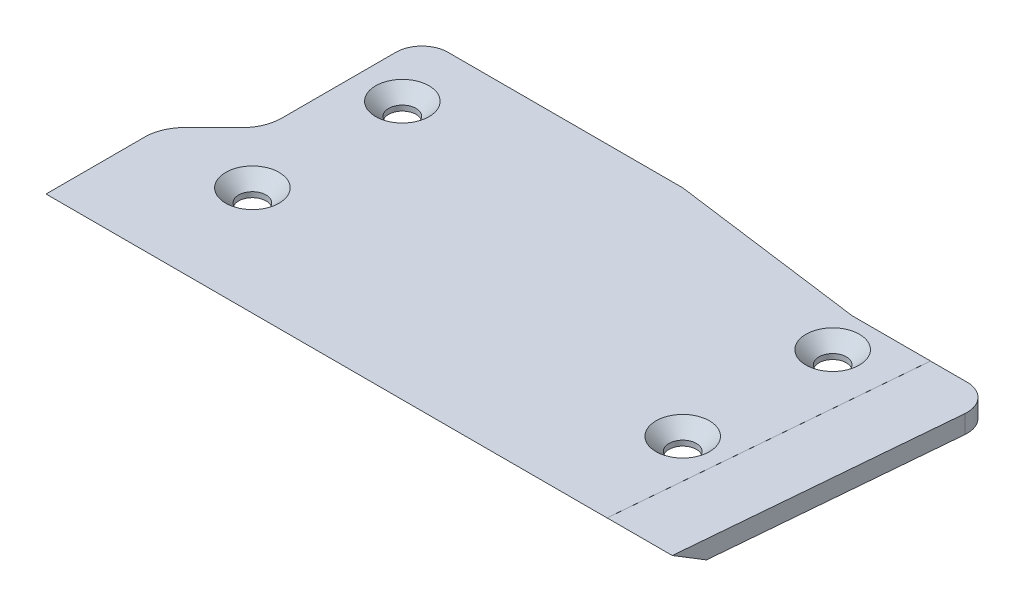
from build123d import *

# Parameters (mm, degrees)
BOSS_EXTRUDE1_DEPTH = 2.8
CHAMFER1_SIZE       = 3
CHAMFER1_SIZE_2     = 5.196152423
SKETCH2_R           = 2.1
CUT_EXTRUDE1_DEPTH  = 103.74283559
CHAMFER2_SIZE       = 2
FILLET1_R           = 6
FILLET2_R           = 4
CUT_EXTRUDE2_DEPTH  = 0.01


with BuildPart() as part:
    # Sketch1 → Boss-Extrude1 (new body)
    with BuildSketch(Plane(origin=(0, 0, 0), x_dir=(1, 0, 0), z_dir=(0, 1, 0))):
        Polygon((0, 4), (40, 4), (70, 0), (92, 0), (88, -46), (0, -46), (-8, -46), (-8, -28), (0, -20), align=None)
    extrude(amount=BOSS_EXTRUDE1_DEPTH)

    # Chamfer1
    # the kernel refuses this chamfer: 5.196152423, 3 mm, written as the material it takes off along each edge
    with BuildSketch(Plane(origin=(-21.442891912, 0, 46), x_dir=(0, 0.9983227437537926, 0.05789386240267091), z_dir=(1, 0, 0))) as chamfer1_piece_1:
        Polygon((CHAMFER1_SIZE * 0.998322743754, -CHAMFER1_SIZE * 0.0578938624027), (-CHAMFER1_SIZE_2 * 0.0578938623994, -CHAMFER1_SIZE_2 * 0.998322743697), (0, 0), align=None)
    extrude(amount=122.885783824, mode=Mode.SUBTRACT)

    # Sketch2 → Cut-Extrude1 (cut, through all)
    with BuildSketch(Plane(origin=(0, 2.8, 0), x_dir=(1, 0, 0), z_dir=(0, 1, 0))):
        with Locations(Location((7, -6, 0), (0, 0, 270))):
            Circle(SKETCH2_R)
        with Locations(Location((7, -29, 0), (0, 0, 270))):
            Circle(SKETCH2_R)
        with Locations(Location((73, -6, 0), (0, 0, 270))):
            Circle(SKETCH2_R)
        with Locations(Location((73, -29, 0), (0, 0, 270))):
            Circle(SKETCH2_R)
    extrude(amount=-CUT_EXTRUDE1_DEPTH, mode=Mode.SUBTRACT)

    # Chamfer2
    chamfer2_edges = [part.edges().sort_by_distance(p)[0] for p in [
        (7, 2.8, 26.9),
        (73, 2.8, 3.9),
        (73, 2.8, 26.9),
        (7, 2.8, 3.9),
    ]]
    chamfer(chamfer2_edges, length=CHAMFER2_SIZE)

    # Fillet1
    fillet1_edges = [part.edges().sort_by_distance(p)[0] for p in [
        (-8, 1.4, 28),
        (0, 1.4, 20),
    ]]
    fillet(fillet1_edges, radius=FILLET1_R)

    # Fillet2
    fillet2_edges = [part.edges().sort_by_distance(p)[0] for p in [
        (0, 1.4, -4),
        (92, 1.4, 0),
    ]]
    fillet(fillet2_edges, radius=FILLET2_R)

    # Sketch3 → Cut-Extrude2 (cut)
    with BuildSketch(Plane(origin=(0, 2.8, 0), x_dir=(1, 0, 0), z_dir=(0, 1, 0))):
        Polygon((78.041306422, -45.653589838), (82.011183799, 0), (92.341682138, 0.80141962), (88.030122623, -45.653589838), align=None)
    extrude(amount=-CUT_EXTRUDE2_DEPTH, mode=Mode.SUBTRACT)


solid = part.part
